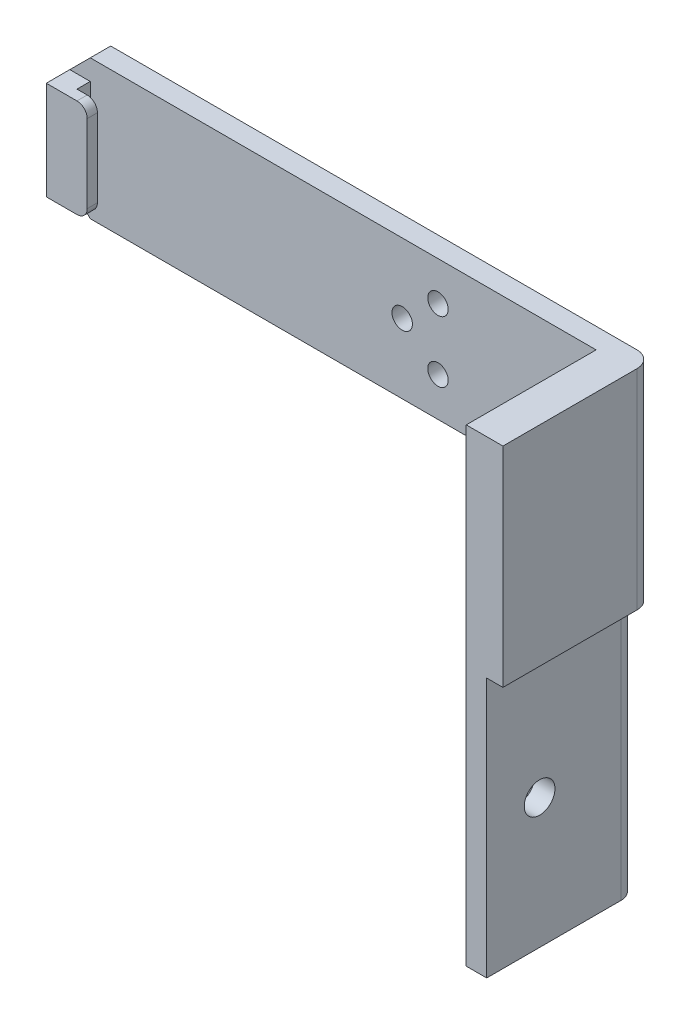
from build123d import *

# Parameters (mm, degrees)
SKETCH1_R                      = 2
PROFILEBOSS_EXTRUDE1_DEPTH     = 4
CORNERBOSS_EXTRUDE2_DEPTH      = 0.0001
CORNERBOSS_EXTRUDE2_DEPTH_BACK = 25.4
SKETCH2_W                      = 4
SKETCH2_H                      = 91.675
BOSS_EXTRUDE3_DEPTH            = 0.0001
BOSS_EXTRUDE3_DEPTH_BACK       = 2.6
SKETCH3_W                      = 4
SKETCH3_H                      = 19.25
BOSS_EXTRUDE4_DEPTH            = 0.0001
BOSS_EXTRUDE4_DEPTH_BACK       = 2
SKETCH5_W                      = 8
SKETCH5_H                      = 19.25
FILLET1_R                      = 2
CHAMFER1_SIZE                  = 4
VSMOUNTHOLECUT_EXTRUDE1_REACH  = 126.934
SKETCH6_R                      = 3
SKETCH7_W                      = 29.4
SKETCH7_H                      = 40.875
THICKSIDEBOSS_EXTRUDE5_DEPTH   = 3.175
FILLET3_R                      = 3.175


with BuildPart() as part:
    # Sketch1 → ProfileBoss-Extrude1 (new body)
    with BuildSketch(Plane.XY):
        Polygon((0, 0), (81.525, 0), (81.525, -64.425), (106.925, -64.425), (106.925, 27.25), (0, 27.25), align=None)
        with Locations((72, 19.625)):
            Circle(SKETCH1_R, mode=Mode.SUBTRACT)
        with Locations((72, 7.625)):
            Circle(SKETCH1_R, mode=Mode.SUBTRACT)
        with Locations((65, 13.625)):
            Circle(SKETCH1_R, mode=Mode.SUBTRACT)
    extrude(amount=PROFILEBOSS_EXTRUDE1_DEPTH)

    # Sketch2 → CornerBoss-Extrude2 (add, two sides: drawn at the far end of the back side and taken through both)
    with BuildSketch(Plane(origin=(0, 0, 4), x_dir=(-1, 0, 0), z_dir=(0, 0, -1)).offset(-CORNERBOSS_EXTRUDE2_DEPTH_BACK)):
        with Locations((-104.925, -18.5875)):
            Rectangle(SKETCH2_W, SKETCH2_H)
    extrude(amount=CORNERBOSS_EXTRUDE2_DEPTH + CORNERBOSS_EXTRUDE2_DEPTH_BACK)

    # Sketch3 → Boss-Extrude3 (add, two sides: drawn at the far end of the back side and taken through both)
    with BuildSketch(Plane(origin=(0, 0, 4), x_dir=(-1, 0, 0), z_dir=(0, 0, -1)).offset(-BOSS_EXTRUDE3_DEPTH_BACK)):
        with Locations((-2, 13.625)):
            Rectangle(SKETCH3_W, SKETCH3_H)
    extrude(amount=BOSS_EXTRUDE3_DEPTH + BOSS_EXTRUDE3_DEPTH_BACK)

    # Sketch5 → Boss-Extrude4 (add, two sides: drawn at the far end of the back side and taken through both)
    with BuildSketch(Plane(origin=(0, 0, 6.6), x_dir=(-1, 0, 0), z_dir=(0, 0, -1)).offset(-BOSS_EXTRUDE4_DEPTH_BACK)):
        with Locations((-4, 13.625)):
            Rectangle(SKETCH5_W, SKETCH5_H)
    extrude(amount=BOSS_EXTRUDE4_DEPTH + BOSS_EXTRUDE4_DEPTH_BACK)

    # Fillet1
    fillet1_edges = [part.edges().sort_by_distance(p)[0] for p in [
        (8, 4, 7.59995),
        (8, 23.25, 7.59995),
    ]]
    fillet(fillet1_edges, radius=FILLET1_R)

    # Chamfer1
    chamfer1_edges = [part.edges().sort_by_distance(p)[0] for p in [
        (0, 27.25, 2),
        (0, 0, 2),
    ]]
    chamfer(chamfer1_edges, length=CHAMFER1_SIZE)

    # Sketch6 → VSMountHoleCut-Extrude1 (cut, up to next)
    with BuildSketch(Plane.ZY.offset(-102.925), mode=Mode.PRIVATE) as vsmountholecut_extrude1_sk1:
        with Locations((19.05, -39.025)):
            Circle(SKETCH6_R)
    vsmountholecut_extrude1_tool1 = extrude(vsmountholecut_extrude1_sk1.sketch, amount=-VSMOUNTHOLECUT_EXTRUDE1_REACH, mode=Mode.PRIVATE) & part.part
    add(vsmountholecut_extrude1_tool1.solids().sort_by_distance((102.925, -39.025, 19.05))[0], mode=Mode.SUBTRACT)

    # Sketch7 → ThickSideBoss-Extrude5 (add)
    with BuildSketch(Plane(origin=(106.925, 0, 0), x_dir=(0, 0, -1), z_dir=(1, 0, 0))):
        with Locations((-14.7, 6.8125)):
            Rectangle(SKETCH7_W, SKETCH7_H)
    extrude(amount=THICKSIDEBOSS_EXTRUDE5_DEPTH)

    # Fillet3
    fillet3_edges = [part.edges().sort_by_distance(p)[0] for p in [
        (106.925, -39.025, 0),
        (110.1, 6.8125, 0),
    ]]
    fillet(fillet3_edges, radius=FILLET3_R - 0.0001)  # a hair under: the kernel refuses the full size


solid = part.part
